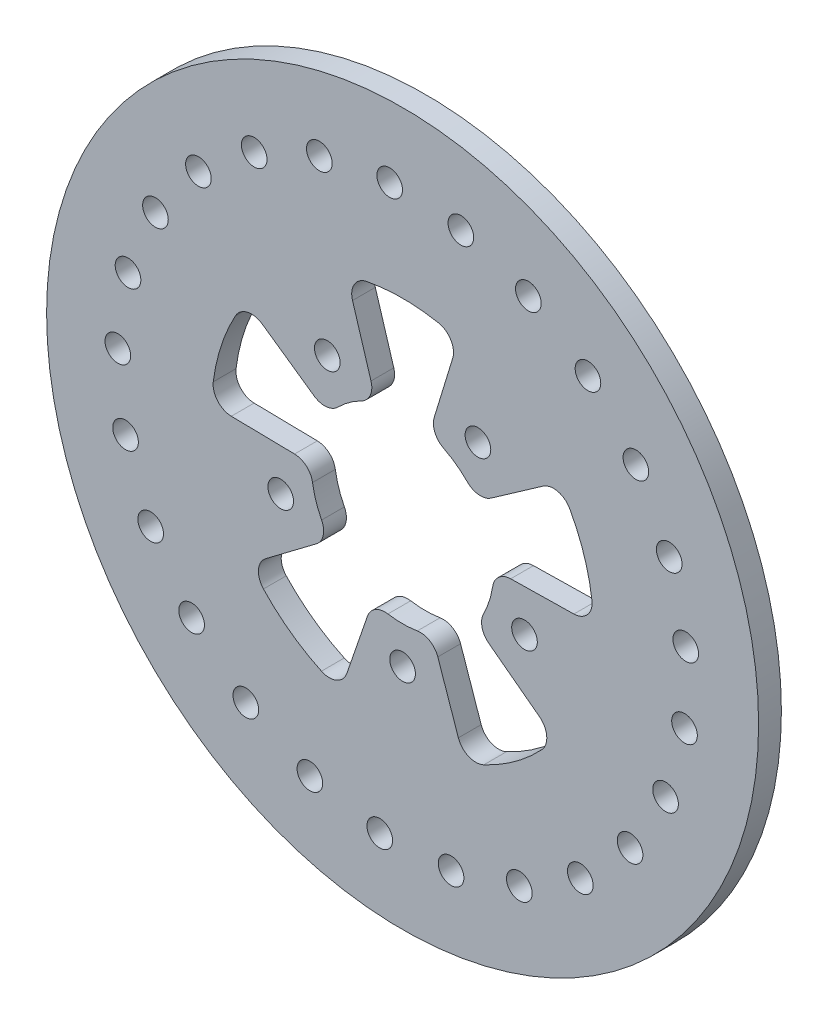
from build123d import *

# Parameters (mm, degrees)
SKETCH1_R               = 125
SKETCH1_R_2             = 32
BOSS_EXTRUDE1_DEPTH     = 4
CUT_EXTRUDE1_REACH      = 178.958
SKETCH2_R               = 4.5
CIRPATTERN2_COUNT       = 5
FILL_START              = -4
FILL_PATTERN1_OUTLINE_R = 4.5
FILL_PATTERN1_DEPTH     = 8
FILLET1_R               = 6.5


# Read off the part's stored shape, not the designer's step: Fill Pattern1
with BuildPart() as part:
    # Sketch1 → Boss-Extrude1 (new, symmetric)
    with BuildSketch(Plane.XY):
        Circle(SKETCH1_R)
        Circle(SKETCH1_R_2, mode=Mode.SUBTRACT)
    extrude(amount=BOSS_EXTRUDE1_DEPTH, both=True)

    # Sketch2 → Cut-Extrude1 (cut, up to next)
    with BuildSketch(Plane.XY.offset(4), mode=Mode.PRIVATE) as cut_extrude1_sk1:
        with BuildLine():
            ThreePointArc((-9.355894551, 30.601752191), (0, 32), (9.355894551, 30.601752191))
            Line((9.355894551, 30.601752191), (19.588904216, 64.07241865))
            ThreePointArc((19.588904216, 64.07241865), (0, 67), (-19.588904216, 64.07241865))
            Line((-19.588904216, 64.07241865), (-9.355894551, 30.601752191))
        make_face()
    cut_extrude1_tool1 = extrude(cut_extrude1_sk1.sketch, amount=-CUT_EXTRUDE1_REACH, mode=Mode.PRIVATE) & part.part
    # Sketch2 → Cut-Extrude1 (cut, up to next)
    with BuildSketch(Plane.XY.offset(4), mode=Mode.PRIVATE) as cut_extrude1_sk2:
        with Locations((-26.450336353, 36.405764747)):
            Circle(SKETCH2_R)
    cut_extrude1_tool2 = extrude(cut_extrude1_sk2.sketch, amount=-CUT_EXTRUDE1_REACH, mode=Mode.PRIVATE) & part.part
    cut_extrude1_1 = cut_extrude1_tool1.solids().sort_by_distance((0, 50.80907, 4))[0]
    add(cut_extrude1_1, mode=Mode.SUBTRACT)
    cut_extrude1_2 = cut_extrude1_tool2.solids().sort_by_distance((-26.450336, 36.405765, 4))[0]
    add(cut_extrude1_2, mode=Mode.SUBTRACT)
    cut_extrude1 = cut_extrude1_1 + cut_extrude1_2  # Cut-Extrude1 as one shape, for the pattern or mirror that repeats it

    # CirPattern2: Cut-Extrude1 ×5 about axis
    cirpattern2_axis = Axis((0, 0, 0), (0, 0, 1))
    for i in range(1, CIRPATTERN2_COUNT):
        add(cut_extrude1.rotate(cirpattern2_axis, i * 360 / CIRPATTERN2_COUNT), mode=Mode.SUBTRACT)

    # Fill Pattern1 outline → Fill Pattern1 (cut)
    with BuildSketch(Plane.XY.offset(FILL_START)):
        with Locations((-99.984772584, 1.745240337)):
            Circle(FILL_PATTERN1_OUTLINE_R)
        with Locations((-97.277590889, -23.174790656)):
            Circle(FILL_PATTERN1_OUTLINE_R)
        with Locations((-88.45810059, -46.638664341)):
            Circle(FILL_PATTERN1_OUTLINE_R)
        with Locations((-74.080462697, -67.172059239)):
            Circle(FILL_PATTERN1_OUTLINE_R)
        with Locations((-55.048077077, -83.484786633)):
            Circle(FILL_PATTERN1_OUTLINE_R)
        with Locations((-32.556818514, -94.551857867)):
            Circle(FILL_PATTERN1_OUTLINE_R)
        with Locations((-8.019895501, -99.677888152)):
            Circle(FILL_PATTERN1_OUTLINE_R)
        with Locations((17.020946849, -98.540790155)):
            Circle(FILL_PATTERN1_OUTLINE_R)
        with Locations((40.992300316, -91.212011924)):
            Circle(FILL_PATTERN1_OUTLINE_R)
        with Locations((62.387956603, -78.152047549)):
            Circle(FILL_PATTERN1_OUTLINE_R)
        with Locations((79.863547937, -60.181502622)):
            Circle(FILL_PATTERN1_OUTLINE_R)
        with Locations((92.321018643, -38.429532573)):
            Circle(FILL_PATTERN1_OUTLINE_R)
        with Locations((98.977620023, -14.262893677)):
            Circle(FILL_PATTERN1_OUTLINE_R)
        with Locations((99.415093329, 10.799935264)):
            Circle(FILL_PATTERN1_OUTLINE_R)
        with Locations((93.605950506, 35.184164534)):
            Circle(FILL_PATTERN1_OUTLINE_R)
        with Locations((81.915201361, 57.357643328)):
            Circle(FILL_PATTERN1_OUTLINE_R)
        with Locations((65.077418659, 75.927130427)):
            Circle(FILL_PATTERN1_OUTLINE_R)
        with Locations((44.150582211, 89.725836661)):
            Circle(FILL_PATTERN1_OUTLINE_R)
        with Locations((20.449602116, 97.886738569)):
            Circle(FILL_PATTERN1_OUTLINE_R)
        with Locations((-4.536301881, 99.897056672)):
            Circle(FILL_PATTERN1_OUTLINE_R)
        with Locations((-29.23717354, 95.63047529)):
            Circle(FILL_PATTERN1_OUTLINE_R)
        with Locations((-52.100966252, 85.355079421)):
            Circle(FILL_PATTERN1_OUTLINE_R)
        with Locations((-71.691063833, 69.716509979)):
            Circle(FILL_PATTERN1_OUTLINE_R)
        with Locations((-86.776548405, 49.697395796)):
            Circle(FILL_PATTERN1_OUTLINE_R)
        with Locations((-96.409543491, 26.555611442)):
            Circle(FILL_PATTERN1_OUTLINE_R)
    extrude(amount=FILL_PATTERN1_DEPTH, mode=Mode.SUBTRACT)

    # Fillet1
    fillet1_edges = [part.edges().sort_by_distance(p)[0] for p in [
        (19.588904216, 64.07241865, 0),
        (9.355894551, 30.601752191, 0),
        (-9.355894551, 30.601752191, 0),
        (-19.588904216, 64.07241865, 0),
        (-53.508579173, -40.321606551, 0),
        (-25.556336322, -19.258080741, 0),
        (-10.418180943, -30.256594419, 0),
        (-21.813066349, -63.349744565, 0),
        (21.813066349, -63.349744565, 0),
        (10.418180943, -30.256594419, 0),
        (25.556336322, -19.258080741, 0),
        (53.508579173, -40.321606551, 0),
        (66.989795575, 1.169311231, 0),
        (31.995126245, 0.558477006, 0),
        (26.212865417, 18.354445963, 0),
        (54.883186967, 38.429621236, 0),
        (-54.883186967, 38.429621236, 0),
        (-26.212865417, 18.354445963, 0),
        (-31.995126245, 0.558477006, 0),
        (-66.989795575, 1.169311231, 0),
    ]]
    fillet(fillet1_edges, radius=FILLET1_R)


solid = part.part
